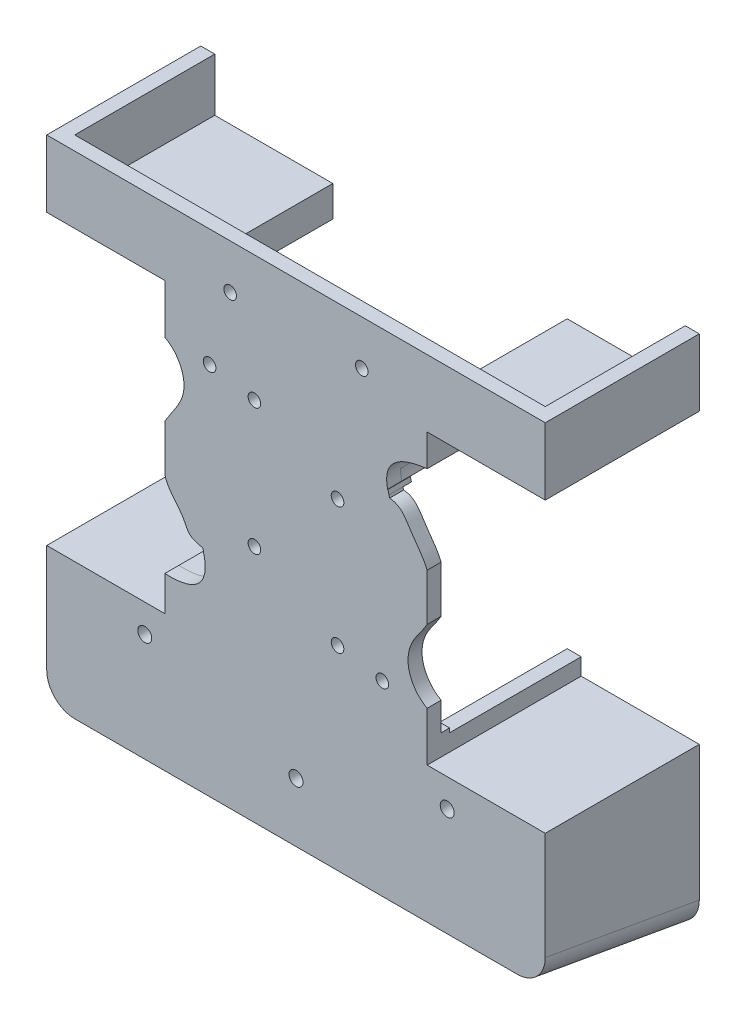
from build123d import *

# Parameters (mm, degrees)
SKETCH1_R            = 2.25
BOSS_EXTRUDE1_DEPTH  = 5
SKETCH7_R            = 2
CUT_EXTRUDE1_DEPTH   = 10
SKETCH10_W           = 93.677769422
SKETCH10_H           = 89.648680449
CUT_EXTRUDE4_DEPTH   = 10
LPATTERN1_COUNT      = 2
LPATTERN1_PITCH      = 144.65
SKETCH13_W           = 93.677769422
SKETCH13_H           = 54.298680449
BOSS_EXTRUDE2_DEPTH  = 5
SKETCH18_W           = 93.677769422
SKETCH18_H           = 5
BOSS_EXTRUDE5_DEPTH  = 5
BOSS_EXTRUDE7_DEPTH  = 8
SKETCH19_W           = 93.677769422
SKETCH19_H           = 5
BOSS_EXTRUDE8_DEPTH  = 61.3
SKETCH21_W           = 93.677769422
SKETCH21_H           = 5
BOSS_EXTRUDE9_DEPTH  = 3
BOSS_EXTRUDE10_DEPTH = 50
SKETCH25_W           = 93.677769422
SKETCH25_H           = 119.069948178
CUT_EXTRUDE6_DEPTH   = 55
SKETCH29_W           = 5
SKETCH29_H           = 58.3
SKETCH29_H_2         = 23.93
BOSS_EXTRUDE12_DEPTH = 42.16
SKETCH34_R           = 2.25
CUT_EXTRUDE10_DEPTH  = 5
BOSS_EXTRUDE13_DEPTH = 50
CUT_EXTRUDE11_DEPTH  = 177.997769422
FILLET1_R            = 10
SKETCH38_R           = 2.5
CUT_EXTRUDE12_DEPTH  = 5


# Read off the part's stored shape, not the designer's step: Boss-Extrude10
with BuildPart() as part:
    # Sketch1 → Boss-Extrude1 (new body)
    with BuildSketch(Plane.XY):
        with BuildLine():
            Line((0, 110), (-46.838884711, 110))
            Line((-46.838884711, 110), (-46.838884711, 100.421650596))
            add(Edge.make_bspline(
                [(-46.838884711, 100.421650596), (-42.226362844, 98.141206473), (-36.711667831, 86.910333368), (-44.527260711, 78.55539065), (-46.838884711, 74.520163403)],
                knots=[0, 0, 0, 0, 0.5133871, 0.998542736, 0.998542736, 0.998542736, 0.998542736], degree=3))
            Line((-46.838884711, 74.520163403), (-46.838884711, 58.109446399))
            add(Edge.make_bspline(
                [(-46.838884711, 58.109446399), (-45.758632516, 53.655222634), (-40.885867203, 50.40646242), (-38.238529072, 43.136574556), (-34.782140744, 42.431604419), (-33.266055192, 42.106985538)],
                knots=[0, 0, 0, 0, 0.587735064, 0.769686025, 1, 1, 1, 1], degree=3))
            add(Edge.make_bspline(
                [(-33.266055192, 42.106985538), (-28.892413212, 26.709459558), (-46.838884711, 27.412777151)],
                knots=[0, 0, 0, 1, 1, 1], degree=2))
            Line((-46.838884711, 27.412777151), (-46.838884711, 7.421650596))
            add(Edge.make_bspline(
                [(-46.838884711, 7.421650596), (-42.226362844, 5.141206473), (-36.711667831, -6.089666632), (-44.527260711, -14.44460935), (-46.838884711, -18.479836597)],
                knots=[0, 0, 0, 0, 0.5133871, 0.998542736, 0.998542736, 0.998542736, 0.998542736], degree=3))
            Line((-46.838884711, -18.479836597), (-46.838884711, -34.890553601))
            add(Edge.make_bspline(
                [(-46.838884711, -34.890553601), (-45.758632516, -39.344777366), (-40.885867203, -42.59353758), (-38.238529072, -49.863425444), (-34.782140744, -50.568395581), (-33.266055192, -50.893014462)],
                knots=[0, 0, 0, 0, 0.587735064, 0.769686025, 1, 1, 1, 1], degree=3))
            add(Edge.make_bspline(
                [(-33.266055192, -50.893014462), (-28.892413212, -66.290540442), (-46.838884711, -65.587222849)],
                knots=[0, 0, 0, 1, 1, 1], degree=2))
            Line((-46.838884711, -65.587222849), (-46.838884711, -70))
            Line((-46.838884711, -70), (0, -70))
            Line((0, -70), (46.838884711, -70))
            Line((46.838884711, -70), (46.838884711, -60.421650596))
            add(Edge.make_bspline(
                [(46.838884711, -60.421650596), (42.982832164, -58.395834606), (38.906182163, -51.871311027), (41.138601483, -41.632996987), (45.188996373, -37.461060264), (46.838884711, -34.520947075)],
                knots=[0, 0, 0, 0, 0.434931401, 0.661677592, 0.998582109, 0.998582109, 0.998582109, 0.998582109], degree=3))
            Line((46.838884711, -34.520947075), (46.838884711, -17.744628899))
            add(Edge.make_bspline(
                [(46.838884711, -17.744628899), (45.396033977, -14.277729688), (40.758990778, -9.004665614), (37.573327769, -2.447994476), (33.443642317, -2.141285146)],
                knots=[0, 0, 0, 0, 0.525454982, 1, 1, 1, 1], degree=3))
            add(Edge.make_bspline(
                [(33.443642317, -2.141285146), (28.416523532, 11.559488336), (46.838884711, 13.634393344)],
                knots=[0, 0, 0, 1, 1, 1], degree=2))
            Line((46.838884711, 13.634393344), (46.838884711, 32.578349404))
            add(Edge.make_bspline(
                [(46.838884711, 32.578349404), (42.982832164, 34.604165394), (38.906182163, 41.128688973), (41.138601483, 51.367003013), (45.188996373, 55.538939736), (46.838884711, 58.479052925)],
                knots=[0, 0, 0, 0, 0.434931401, 0.661677592, 0.998582109, 0.998582109, 0.998582109, 0.998582109], degree=3))
            Line((46.838884711, 58.479052925), (46.838884711, 75.255371101))
            add(Edge.make_bspline(
                [(46.838884711, 75.255371101), (45.396033977, 78.722270312), (40.758990778, 83.995334386), (37.573327769, 90.552005524), (33.443642317, 90.858714854)],
                knots=[0, 0, 0, 0, 0.525454982, 1, 1, 1, 1], degree=3))
            Line((33.443642317, 90.858714854), (0, 110))
        make_face()
        with Locations((-14.838884711, -41.25)):
            Circle(SKETCH1_R, mode=Mode.SUBTRACT)
        with Locations((-30.838884711, 7)):
            Circle(SKETCH1_R, mode=Mode.SUBTRACT)
        with Locations((-14.838884711, 4)):
            Circle(SKETCH1_R, mode=Mode.SUBTRACT)
        with Locations((14.838884711, -57)):
            Circle(SKETCH1_R, mode=Mode.SUBTRACT)
        with Locations((30.838884711, -60)):
            Circle(SKETCH1_R, mode=Mode.SUBTRACT)
        with Locations((14.838884711, -11.75)):
            Circle(SKETCH1_R, mode=Mode.SUBTRACT)
        with Locations((-14.838884711, 51.75)):
            Circle(SKETCH1_R, mode=Mode.SUBTRACT)
        with Locations((-30.838884711, 100)):
            Circle(SKETCH1_R, mode=Mode.SUBTRACT)
        with Locations((-14.838884711, 97)):
            Circle(SKETCH1_R, mode=Mode.SUBTRACT)
        with Locations((14.838884711, 36)):
            Circle(SKETCH1_R, mode=Mode.SUBTRACT)
        with Locations((30.838884711, 33)):
            Circle(SKETCH1_R, mode=Mode.SUBTRACT)
        with Locations((14.838884711, 81.25)):
            Circle(SKETCH1_R, mode=Mode.SUBTRACT)
    extrude(amount=BOSS_EXTRUDE1_DEPTH)

    # Sketch7 → Cut-Extrude1 (cut)
    with BuildSketch(Plane.XY.offset(5)):
        with Locations((-41.838884711, 23.5)):
            Circle(SKETCH7_R)
        with Locations((-41.838884711, 67)):
            Circle(SKETCH7_R)
        with Locations((40.861115289, 67)):
            Circle(SKETCH7_R)
        with Locations((40.861115289, 23.5)):
            Circle(SKETCH7_R)
    extrude(amount=-CUT_EXTRUDE1_DEPTH, mode=Mode.SUBTRACT)

    # Sketch10 → Cut-Extrude4 (cut)
    with BuildSketch(Plane.XY.offset(5)):
        with Locations((0, 65.175659775)):
            Rectangle(SKETCH10_W, SKETCH10_H)
    extrude(amount=-CUT_EXTRUDE4_DEPTH, mode=Mode.SUBTRACT)


with BuildPart() as lpattern1_1:
    # LPattern1: pattern copy
    add(part.part.moved(Location(Vector(0, -1, 0) * (1 * LPATTERN1_PITCH))))


with BuildPart() as part_1:
    add(part.part)

    add(lpattern1_1.part)  # Boss-Extrude2 merges LPattern1_1
    # Sketch13 → Boss-Extrude2 (add)
    with BuildSketch(Plane.XY.offset(5)):
        with Locations((0, -97.149340225)):
            Rectangle(SKETCH13_W, SKETCH13_H)
    extrude(amount=-BOSS_EXTRUDE2_DEPTH)

    # Sketch18 → Boss-Extrude5 (add)
    with BuildSketch(Plane.XY.offset(5)):
        with Locations((0, -217.15)):
            Rectangle(SKETCH18_W, SKETCH18_H)
    extrude(amount=-BOSS_EXTRUDE5_DEPTH)

    # Sketch17 → Boss-Extrude7 (add)
    with BuildSketch(Plane.XY.offset(5)):
        Polygon((33.137486483, -1.25), (4.338884711, -1.25), (4.338884711, -70.5), (46.838884711, -70.5), (46.838884711, -72), (2.838884711, -72), (2.838884711, 0.25), (32.841973097, 0.25), (33.225056852, -1.25), align=None)
        Polygon((-33.036788629, -51.75), (-4.338884711, -51.75), (-4.338884711, 17.5), (-46.838884711, 17.5), (-46.838884711, 19), (-2.838884711, 19), (-2.838884711, -53.25), (-32.814550412, -53.25), (-33.107034097, -51.75), align=None)
        Polygon((-33.036788629, -196.4), (-4.338884711, -196.4), (-4.338884711, -127.15), (-46.838884711, -127.15), (-46.838884711, -125.65), (-2.838884711, -125.65), (-2.838884711, -197.9), (-32.814550412, -197.9), (-33.107034097, -196.4), align=None)
        Polygon((33.137486483, -145.9), (4.338884711, -145.9), (4.338884711, -215.15), (46.838884711, -215.15), (46.838884711, -216.65), (2.838884711, -216.65), (2.838884711, -144.4), (32.841973097, -144.4), (33.225056852, -145.9), align=None)
    extrude(amount=-BOSS_EXTRUDE7_DEPTH)

    # Sketch19 → Boss-Extrude8 (add)
    with BuildSketch(Plane.XZ.offset(219.65)):
        with Locations((0, 2.5)):
            Rectangle(SKETCH19_W, SKETCH19_H)
    extrude(amount=BOSS_EXTRUDE8_DEPTH)

    # Sketch21 → Boss-Extrude9 (add)
    with BuildSketch(Plane(origin=(0, 20.351319551, 0), x_dir=(1, 0, 0), z_dir=(0, 1, 0))):
        with Locations((0, -2.5)):
            Rectangle(SKETCH21_W, SKETCH21_H)
    extrude(amount=BOSS_EXTRUDE9_DEPTH)

    # Boss-Extrude10 outline → Boss-Extrude10 (add)
    with BuildSketch(Plane(origin=(0, 0, 0), x_dir=(-1, 0, 0), z_dir=(0, 0, -1))):
        with BuildLine():
            add(Edge.make_bspline(
                [(-32.724261898, 0.25), (-32.245095706, 2.312784936), (-32.402626668, 4.067426464)],
                knots=[0, 0, 0, 0.181136716, 0.181136716, 0.181136716], degree=2))
            Line((-32.724261898, 0.25), (-29.65751977, 0.25))
            add(Edge.make_bspline(
                [(-29.65751977, 0.25), (-29.601842647, 0.538366952), (-29.466363581, 1.344697446), (-29.301208708, 3.141766485), (-29.47061633, 5.619429231), (-30.412970229, 8.408598154), (-32.080129332, 10.83738709), (-34.332026266, 12.794823629), (-37.046086715, 14.308755459), (-39.670197714, 15.260630902), (-41.969837518, 15.859321379), (-43.221486034, 16.113254715), (-43.838884711, 16.22336356)],
                knots=[0.025422655, 0.025422655, 0.025422655, 0.025422655, 0.057672577, 0.115345154, 0.230690308, 0.346035462, 0.461380617, 0.576725771, 0.692070925, 0.807416079, 0.865088656, 0.922761233, 0.922761233, 0.922761233, 0.922761233], degree=3))
            Line((-43.838884711, 16.22336356), (-43.838884711, 20.351319551))
            Line((-43.838884711, 20.351319551), (43.838884711, 20.351319551))
            Line((43.838884711, 20.351319551), (43.838884711, 19))
            Line((43.838884711, 19), (46.838884711, 19))
            Line((46.838884711, 19), (46.838884711, 23.351319551))
            Line((46.838884711, 23.351319551), (-46.838884711, 23.351319551))
            Line((-46.838884711, 23.351319551), (-46.838884711, 13.634393344))
            add(Edge.make_bspline(
                [(-32.402626668, 4.067426464), (-33.094751911, 12.086395793), (-46.838884711, 13.634393344)],
                knots=[0.25394293, 0.25394293, 0.25394293, 1, 1, 1], degree=2))
        make_face()
        with BuildLine():
            add(Edge.make_bspline(
                [(32.709776931, -53.25), (31.734780647, -58.560461643), (33.920713563, -61.590754477)],
                knots=[0.079873384, 0.079873384, 0.079873384, 0.456195017, 0.456195017, 0.456195017], degree=2))
            Line((32.709776931, -53.25), (27.672993194, -53.25))
            add(Edge.make_bspline(
                [(27.672993194, -53.25), (27.634044039, -53.603919753), (27.549470722, -54.53429273), (27.478130031, -56.55603599), (27.696443256, -59.281114668), (28.584970164, -62.41153087), (30.219766888, -65.27653857), (32.567186832, -67.613698936), (35.393773129, -69.256198214), (37.979457465, -70.085815151), (40.144646291, -70.485795849), (41.276481585, -70.607362141), (41.838884711, -70.649060215)],
                knots=[0.020227728, 0.020227728, 0.020227728, 0.020227728, 0.052559154, 0.105118307, 0.210236615, 0.315354922, 0.42047323, 0.525591537, 0.630709845, 0.735828152, 0.788387306, 0.840946459, 0.840946459, 0.840946459, 0.840946459], degree=3))
            Line((41.838884711, -70.649060215), (46.838884711, -70.649060215))
            Line((46.838884711, -70.649060215), (46.838884711, -65.587222848))
            add(Edge.make_bspline(
                [(33.920713563, -61.590754477), (36.999202525, -66.479878046), (46.838884711, -65.587222848)],
                knots=[0.383965009, 0.383965009, 0.383965009, 1, 1, 1], degree=2))
        make_face()
        with BuildLine():
            add(Edge.make_bspline(
                [(-32.724261899, -144.4), (-32.245095735, -142.337215187), (-32.40262665, -140.582573745)],
                knots=[0, 0, 0, 0.181136705, 0.181136705, 0.181136705], degree=2))
            Line((-32.724261899, -144.4), (-27.624350546, -144.4))
            add(Edge.make_bspline(
                [(-27.624350546, -144.4), (-27.502918691, -143.696257513), (-27.293028635, -141.891316279), (-27.435749972, -139.015823852), (-28.37747966, -135.845139515), (-30.113029916, -133.024976386), (-32.462833621, -130.741878365), (-35.232498366, -128.995170141), (-37.82646734, -127.905854752), (-40.056119375, -127.214276507), (-41.247409264, -126.918228045), (-41.838884711, -126.786845404)],
                knots=[0.038284512, 0.038284512, 0.038284512, 0.038284512, 0.109248652, 0.218497304, 0.327745955, 0.436994607, 0.546243259, 0.655491911, 0.764740563, 0.819364888, 0.873989214, 0.873989214, 0.873989214, 0.873989214], degree=3))
            Line((-41.838884711, -126.786845404), (-46.838884711, -126.786845404))
            Line((-46.838884711, -126.786845404), (-46.838884711, -131.015606656))
            add(Edge.make_bspline(
                [(-32.40262665, -140.582573745), (-33.094751732, -132.563604227), (-46.838884711, -131.015606656)],
                knots=[0.25394292, 0.25394292, 0.25394292, 1, 1, 1], degree=2))
        make_face()
        with BuildLine():
            add(Edge.make_bspline(
                [(32.709776931, -197.9), (31.734780645, -203.210461655), (33.920713573, -206.240754491)],
                knots=[0.079873384, 0.079873384, 0.079873384, 0.456195018, 0.456195018, 0.456195018], degree=2))
            Line((32.709776931, -197.9), (27.672993196, -197.9))
            add(Edge.make_bspline(
                [(27.672993196, -197.9), (27.63404404, -198.253919753), (27.549470724, -199.184292729), (27.478130032, -201.206035989), (27.696443257, -203.931114667), (28.584970165, -207.061530869), (30.219766889, -209.926538569), (32.567186833, -212.263698935), (35.393773129, -213.906198214), (37.979457465, -214.73581515), (40.144646291, -215.135795849), (41.276481585, -215.25736214), (41.838884711, -215.299060215)],
                knots=[0.020227728, 0.020227728, 0.020227728, 0.020227728, 0.052559154, 0.105118307, 0.210236615, 0.315354922, 0.42047323, 0.525591537, 0.630709845, 0.735828152, 0.788387306, 0.84094646, 0.84094646, 0.84094646, 0.84094646], degree=3))
            Line((41.838884711, -215.299060215), (46.838884711, -215.299060215))
            Line((46.838884711, -215.299060215), (46.838884711, -210.237222849))
            add(Edge.make_bspline(
                [(33.920713573, -206.240754491), (36.999202539, -211.129878044), (46.838884711, -210.237222849)],
                knots=[0.38396501, 0.38396501, 0.38396501, 1, 1, 1], degree=2))
        make_face()
    extrude(amount=BOSS_EXTRUDE10_DEPTH)

    # Sketch25 → Cut-Extrude6 (cut)
    with BuildSketch(Plane.XY.offset(5)):
        with Locations((0, -36.183654538)):
            Rectangle(SKETCH25_W, SKETCH25_H)
    extrude(amount=-CUT_EXTRUDE6_DEPTH, mode=Mode.SUBTRACT)

    # Sketch29 → Boss-Extrude12 (add)
    with BuildSketch(Plane(origin=(46.838884711, 0, 0), x_dir=(0, 0, -1), z_dir=(1, 0, 0))):
        with Locations((-2.5, -251.8)):
            Rectangle(SKETCH29_W, SKETCH29_H)
        with Locations((-2.5, -107.683628627)):
            Rectangle(SKETCH29_W, SKETCH29_H_2)
    boss_extrude12 = extrude(amount=BOSS_EXTRUDE12_DEPTH)

    # Mirror1: Boss-Extrude12 across plane
    add(boss_extrude12.mirror(Plane(origin=(0, 0, 0), x_dir=(0, 0, 1), z_dir=(1, 0, 0))))

    # Sketch34 → Cut-Extrude10 (cut)
    with BuildSketch(Plane.XY.offset(5)):
        with Locations((-23.501115289, -111.648680449)):
            Circle(SKETCH34_R)
        with Locations((23.498884711, -111.648680449)):
            Circle(SKETCH34_R)
    extrude(amount=-CUT_EXTRUDE10_DEPTH, mode=Mode.SUBTRACT)

    # Sketch35 → Boss-Extrude13 (add)
    with BuildSketch(Plane(origin=(0, 0, 0), x_dir=(-1, 0, 0), z_dir=(0, 0, -1))):
        Polygon((-41.838884711, -216.65), (-46.838884711, -216.65), (-46.838884711, -222.65), (-88.998884711, -222.65), (-88.998884711, -280.95), (88.998884711, -280.95), (88.998884711, -222.65), (46.838884711, -222.65), (46.838884711, -215.299060215), (41.838884711, -215.299060215), (41.838884711, -227.65), (83.998884711, -227.65), (83.998884711, -270.95), (-83.998884711, -270.95), (-83.998884711, -227.65), (-41.838884711, -227.65), align=None)
        Polygon((-46.838884711, -119.648628627), (-46.838884711, -126.786845404), (-41.838884711, -126.786845404), (-41.838884711, -114.648628627), (-83.998884711, -114.648628627), (-83.998884711, -95.718628627), (-88.998884711, -95.718628627), (-88.998884711, -119.648628627), align=None)
        Polygon((88.998884711, -95.718628627), (83.998884711, -95.718628627), (83.998884711, -114.648628627), (41.838884711, -114.648628627), (41.838884711, -125.65), (46.838884711, -125.65), (46.838884711, -119.648628627), (88.998884711, -119.648628627), align=None)
    extrude(amount=BOSS_EXTRUDE13_DEPTH)

    # Sketch36 → Cut-Extrude11 (cut)
    with BuildSketch(Plane.ZY.offset(88.998884711)):
        Polygon((-50, -280.95), (5, -271.252016061), (5, -280.95), align=None)
    extrude(amount=-CUT_EXTRUDE11_DEPTH, mode=Mode.SUBTRACT)

    # Fillet1
    fillet1_edges = [part_1.edges().sort_by_distance(p)[0] for p in [
        (-88.998884711, -276.101008031, -22.5),
        (88.998884711, -276.101008031, -22.5),
    ]]
    fillet(fillet1_edges, radius=FILLET1_R)

    # Sketch38 → Cut-Extrude12 (cut)
    with BuildSketch(Plane.XY.offset(5)):
        with Locations((-53.998884711, -232.652016061)):
            Circle(SKETCH38_R)
        with Locations((0.001115289, -250.152016061)):
            Circle(SKETCH38_R)
        with Locations((54.001115289, -232.652016061)):
            Circle(SKETCH38_R)
    extrude(amount=-CUT_EXTRUDE12_DEPTH, mode=Mode.SUBTRACT)


solid = part_1.part
